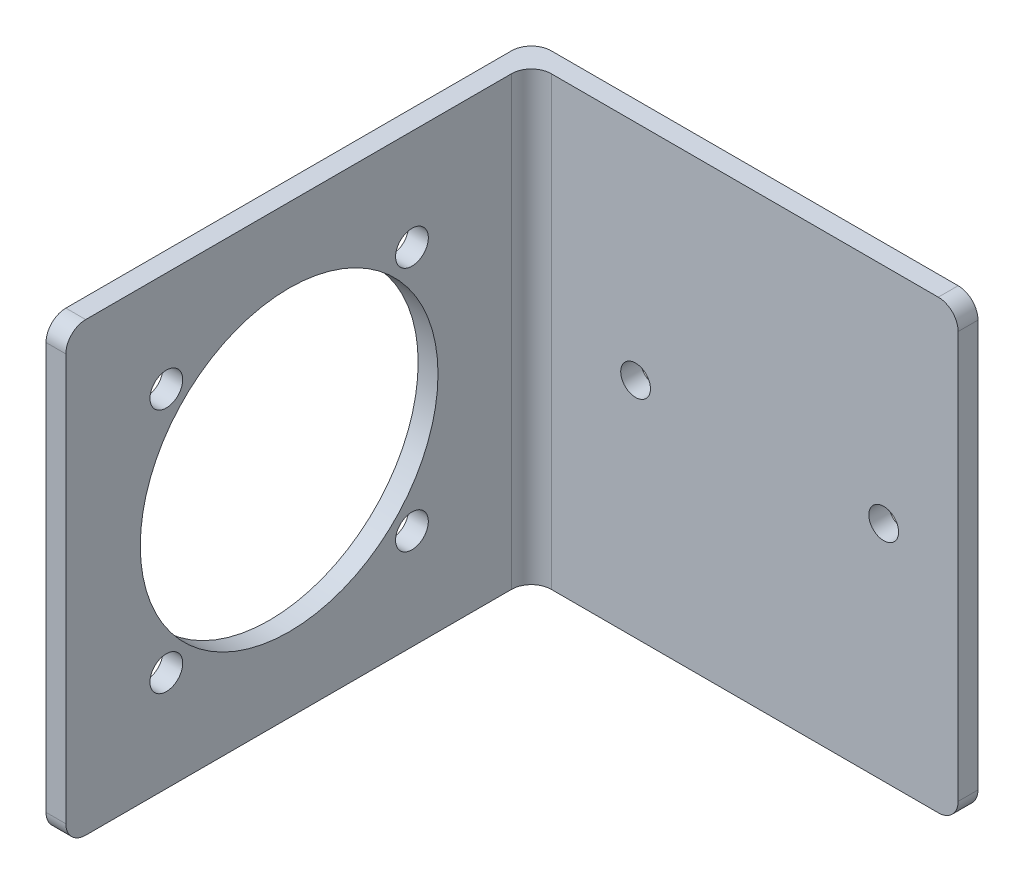
from build123d import *

# Parameters (mm, degrees)
EXTRUDE_1_DEPTH     = 45
FILLET_1_R          = 2
SKETCH_2_R          = 15
CUT_EXTRUDE_1_DEPTH = 10
FILLET_2_R          = 2
SKETCH_4_R          = 1.65
CUT_EXTRUDE_2_DEPTH = 10
SKETCH_5_R          = 1.5
CUT_EXTRUDE_3_DEPTH = 10


with BuildPart() as part:
    # 草图1 → 拉伸-薄壁1 (new body)
    with BuildSketch(Plane(origin=(0, 0, 0), x_dir=(1, 0, 0), z_dir=(0, 1, 0))):
        Polygon((0, 0), (0, 48.91), (45, 48.91), (45, 46.91), (2, 46.91), (2, 0), align=None)
    extrude(amount=EXTRUDE_1_DEPTH)

    # 圆角1
    fillet_1_edges = [part.edges().sort_by_distance(p)[0] for p in [
        (2, 22.5, -46.91),
        (0, 22.5, -48.91),
    ]]
    fillet(fillet_1_edges, radius=FILLET_1_R)

    # 草图2 → 切除-拉伸1 (cut)
    with BuildSketch(Plane.ZY):
        with Locations((-22.5, 22.5)):
            Circle(SKETCH_2_R)
    extrude(amount=-CUT_EXTRUDE_1_DEPTH, mode=Mode.SUBTRACT)

    # 圆角2
    fillet_2_edges = [part.edges().sort_by_distance(p)[0] for p in [
        (45, 0, -47.91),
        (45, 45, -47.91),
        (1, 0, 0),
        (1, 45, 0),
    ]]
    fillet(fillet_2_edges, radius=FILLET_2_R)

    # 草图4 → 切除-拉伸2 (cut)
    with BuildSketch(Plane.ZY):
        with Locations((-34.874368671, 10.125631329)):
            Circle(SKETCH_4_R)
        with Locations((-10.125631329, 10.125631329)):
            Circle(SKETCH_4_R)
        with Locations((-10.125631329, 34.874368671)):
            Circle(SKETCH_4_R)
        with Locations((-34.874368671, 34.874368671)):
            Circle(SKETCH_4_R)
    extrude(amount=-CUT_EXTRUDE_2_DEPTH, mode=Mode.SUBTRACT)

    # 草图5 → 切除-拉伸3 (cut)
    with BuildSketch(Plane.XY.offset(-46.91)):
        with Locations((12.5, 22.5)):
            Circle(SKETCH_5_R)
        with Locations((37.5, 22.5)):
            Circle(SKETCH_5_R)
    extrude(amount=-CUT_EXTRUDE_3_DEPTH, mode=Mode.SUBTRACT)


solid = part.part
